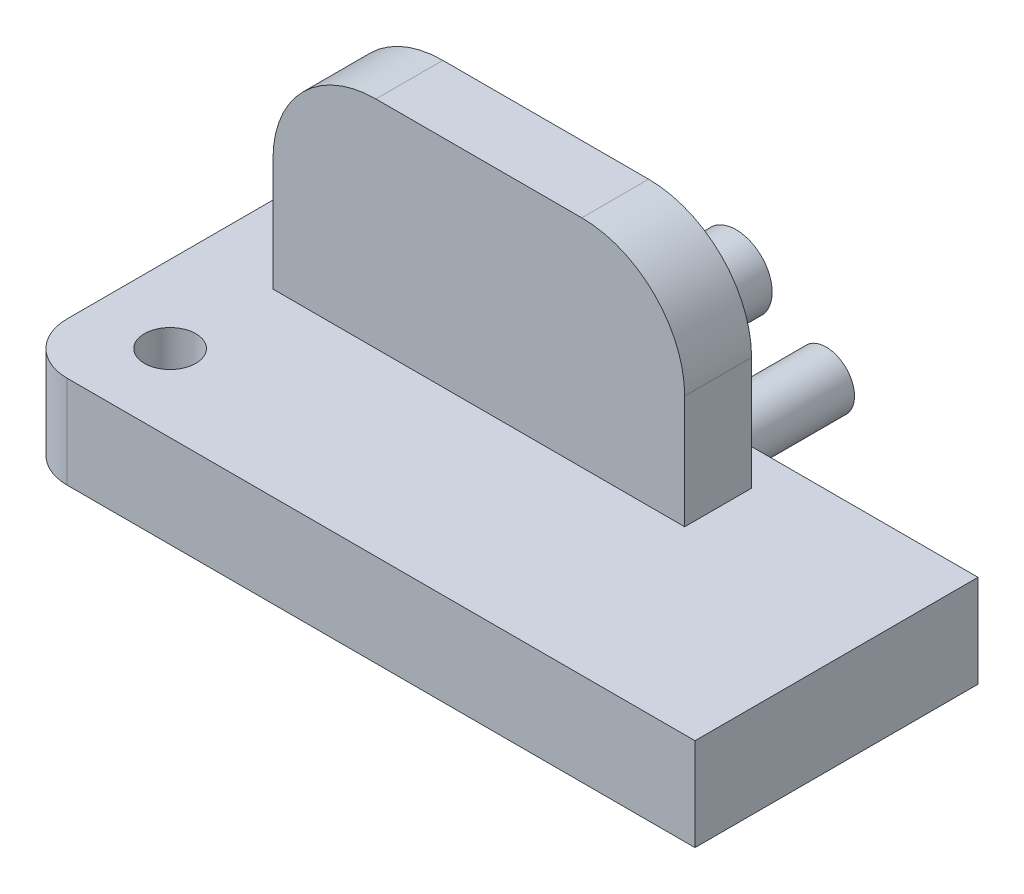
from build123d import *

# Parameters (mm, degrees)
BOSS_EXTRUDE2_DEPTH      = 8
BOSS_EXTRUDE2_DEPTH_BACK = 1
SKETCH1_R                = 2.5
CUT_EXTRUDE1_START       = -16
SKETCH2_R                = 2.5
CUT_EXTRUDE1_DEPTH       = 16
SKETCH3_R                = 2.75
BOSS_EXTRUDE3_DEPTH      = 13.75
SKETCH4_W                = 9
SKETCH4_H                = 6.5
BOSS_EXTRUDE4_DEPTH      = 15
BOSS_EXTRUDE5_DEPTH      = 8.5
SKETCH8_W                = 9
SKETCH8_H                = 6.5
BOSS_EXTRUDE6_DEPTH      = 6
SKETCH9_W                = 15.5
SKETCH9_H                = 6.5
BOSS_EXTRUDE7_DEPTH      = 21
SKETCH10_R               = 3.5
BOSS_EXTRUDE8_DEPTH      = 8.5
CUT_EXTRUDE2_START       = -8.5
SKETCH12_R               = 3.5
CUT_EXTRUDE2_DEPTH       = 8.5
FILLET1_R                = 10
BOSS_EXTRUDE9_DEPTH      = 11
BOSS_EXTRUDE9_DEPTH_BACK = 11
SKETCH13_W               = 27.5
SKETCH13_H               = 9


with BuildPart() as part:
    # Sketch1 → Boss-Extrude2 (new, two sides: drawn at the far end of the back side and taken through both)
    with BuildSketch(Plane(origin=(0, 0, 0), x_dir=(1, 0, 0), z_dir=(0, 1, 0)).offset(-BOSS_EXTRUDE2_DEPTH_BACK)):
        with BuildLine():
            Line((5, 0), (50, 0))
            ThreePointArc((50, 0), (53.535533906, 1.464466094), (55, 5))
            Line((55, 5), (55, 50))
            ThreePointArc((55, 50), (53.535533906, 53.535533906), (50, 55))
            Line((50, 55), (5, 55))
            ThreePointArc((5, 55), (1.464466094, 53.535533906), (0, 50))
            Line((0, 50), (0, 5))
            ThreePointArc((0, 5), (1.464466094, 1.464466094), (5, 0))
        make_face()
        with Locations((7.5, 47.5)):
            Circle(SKETCH1_R, mode=Mode.SUBTRACT)
        with Locations((47.5, 47.5)):
            Circle(SKETCH1_R, mode=Mode.SUBTRACT)
        with Locations((47.5, 7.5)):
            Circle(SKETCH1_R, mode=Mode.SUBTRACT)
        with Locations((7.5, 7.5)):
            Circle(SKETCH1_R, mode=Mode.SUBTRACT)
    extrude(amount=BOSS_EXTRUDE2_DEPTH + BOSS_EXTRUDE2_DEPTH_BACK)

    # Sketch2 → Cut-Extrude1 (cut)
    with BuildSketch(Plane(origin=(0, 8, 0), x_dir=(1, 0, 0), z_dir=(0, 1, 0)).offset(CUT_EXTRUDE1_START)):
        with BuildLine():
            Line((0, 50), (0, 27.5))
            Line((0, 27.5), (55, 27.5))
            Line((55, 27.5), (55, 50))
            ThreePointArc((55, 50), (53.535533906, 53.535533906), (50, 55))
            Line((50, 55), (5, 55))
            ThreePointArc((5, 55), (1.464466094, 53.535533906), (0, 50))
        make_face()
        with Locations((7.5, 47.5)):
            Circle(SKETCH2_R, mode=Mode.SUBTRACT)
        with Locations((47.5, 47.5)):
            Circle(SKETCH2_R, mode=Mode.SUBTRACT)
    extrude(amount=CUT_EXTRUDE1_DEPTH, mode=Mode.SUBTRACT)

    # Sketch3 → Boss-Extrude3 (add)
    with BuildSketch(Plane(origin=(0, 0, -27.5), x_dir=(-1, 0, 0), z_dir=(0, 0, -1))):
        with Locations((-37.5, 3.5)):
            Circle(SKETCH3_R)
        with Locations((-17.5, 3.5)):
            Circle(SKETCH3_R)
    extrude(amount=BOSS_EXTRUDE3_DEPTH)

    # Sketch4 → Boss-Extrude4 (add)
    with BuildSketch(Plane(origin=(0, 8, 0), x_dir=(1, 0, 0), z_dir=(0, 1, 0))):
        with Locations((27.5, 20.75)):
            Rectangle(SKETCH4_W, SKETCH4_H)
    extrude(amount=BOSS_EXTRUDE4_DEPTH)

    # Sketch5 → Boss-Extrude5 (add)
    with BuildSketch(Plane(origin=(0, 0, -24), x_dir=(-1, 0, 0), z_dir=(0, 0, -1))):
        with BuildLine():
            ThreePointArc((-25.636419782, 13.037388184), (-24.436298745, 14.307742745), (-24, 16))
            ThreePointArc((-24, 16), (-29.974873734, 18.474873734), (-27.5, 12.5))
            ThreePointArc((-27.5, 12.5), (-26.685966178, 12.595980474), (-25.916578842, 12.878657751))
            ThreePointArc((-25.916578842, 12.878657751), (-25.85405917, 13.094916041), (-25.636419782, 13.037388184))
        make_face()
    extrude(amount=BOSS_EXTRUDE5_DEPTH)

    # Sketch8 → Boss-Extrude6 (add)
    with BuildSketch(Plane(origin=(0, 23, 0), x_dir=(1, 0, 0), z_dir=(0, 1, 0))):
        with Locations((27.5, 20.75)):
            Rectangle(SKETCH8_W, SKETCH8_H)
    extrude(amount=BOSS_EXTRUDE6_DEPTH)

    # Sketch9 → Boss-Extrude7 (add)
    with BuildSketch(Plane(origin=(0, 8, 0), x_dir=(1, 0, 0), z_dir=(0, 1, 0))):
        with Locations((39.75, 20.75)):
            Rectangle(SKETCH9_W, SKETCH9_H)
        with Locations((15.25, 20.75)):
            Rectangle(SKETCH9_W, SKETCH9_H)
    extrude(amount=BOSS_EXTRUDE7_DEPTH)

    # Sketch10 → Boss-Extrude8 (add)
    with BuildSketch(Plane(origin=(0, 0, -24), x_dir=(-1, 0, 0), z_dir=(0, 0, -1))):
        with Locations((-17.5, 17)):
            Circle(SKETCH10_R)
        with Locations((-37.5, 17)):
            Circle(SKETCH10_R)
    extrude(amount=BOSS_EXTRUDE8_DEPTH)

    # Sketch12 → Cut-Extrude2 (cut)
    with BuildSketch(Plane(origin=(0, 0, -32.5), x_dir=(-1, 0, 0), z_dir=(0, 0, -1)).offset(CUT_EXTRUDE2_START)):
        with Locations((-27.5, 16)):
            Circle(SKETCH12_R)
    extrude(amount=CUT_EXTRUDE2_DEPTH, mode=Mode.SUBTRACT)

    # Fillet1
    fillet1_edges = [part.edges().sort_by_distance(p)[0] for p in [
        (47.5, 29, -20.75),
        (7.5, 29, -20.75),
    ]]
    fillet(fillet1_edges, radius=FILLET1_R)

    # Sketch13 → Boss-Extrude9 (add, two sides: drawn at the far end of the back side and taken through both)
    with BuildSketch(Plane(origin=(55, 0, 0), x_dir=(0, 0, -1), z_dir=(1, 0, 0)).offset(-BOSS_EXTRUDE9_DEPTH_BACK)):
        with Locations((13.75, 3.5)):
            Rectangle(SKETCH13_W, SKETCH13_H)
    extrude(amount=BOSS_EXTRUDE9_DEPTH + BOSS_EXTRUDE9_DEPTH_BACK)


solid = part.part
